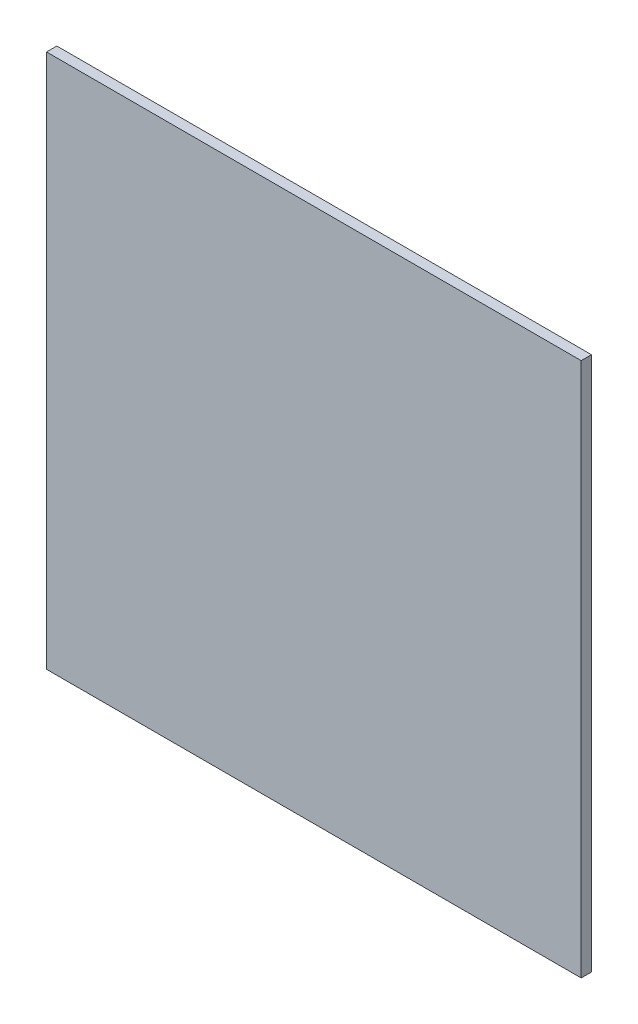
from build123d import *

# Parameters (mm, degrees)
SKETCH1_W           = 330.2
SKETCH1_H           = 330.2
BOSS_EXTRUDE1_DEPTH = 3.175


with BuildPart() as part:
    # Sketch1 → Boss-Extrude1 (new, symmetric)
    with BuildSketch(Plane.XY):
        Rectangle(SKETCH1_W, SKETCH1_H)
    extrude(amount=BOSS_EXTRUDE1_DEPTH, both=True)


solid = part.part
